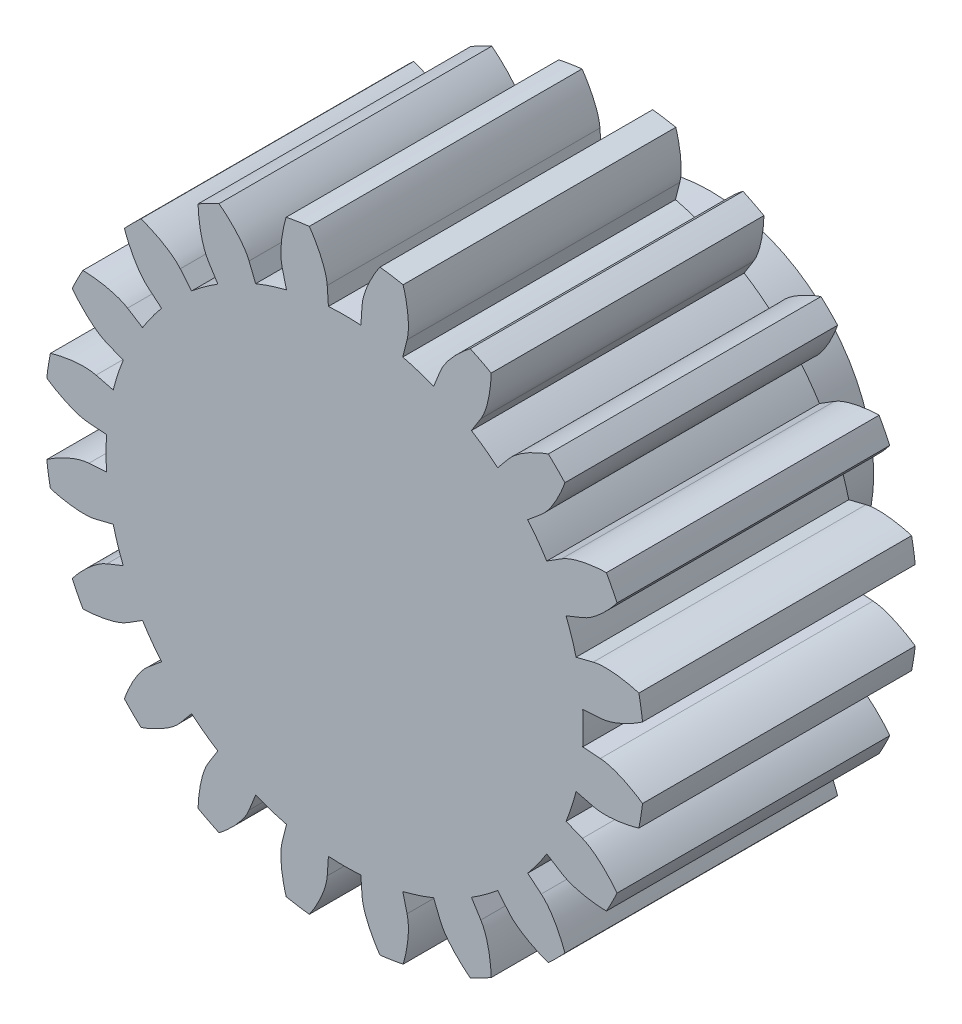
from build123d import *

# Parameters (mm, degrees)
SKETCH_1_R               = 5.5
SKETCH_1_R_2             = 1.475
EXTRUDE_1_DEPTH          = 5
CUT_EXTRUDE_1_DEPTH      = 10.246621004
PATTERN_CIRCULAR_1_DEPTH = 5
SKETCH_2_R               = 1.475
EXTRUDE_2_DEPTH          = 5
SKETCH_3_R               = 3
SKETCH_3_R_2             = 2
SKETCH_3_W               = 2
SKETCH_3_H               = 0.5
SKETCH_3_W_2             = 0.5
SKETCH_3_H_2             = 2
EXTRUDE_3_DEPTH          = 1.7
CUT_EXTRUDE_START        = -1
SKETCH_5_R               = 2
CUT_EXTRUDE_2_DEPTH      = 1


# Read off the part's stored shape, not the designer's step: 阵列(圆周)1
with BuildPart() as part:
    # 草图1 → 凸台-拉伸1 (new body)
    with BuildSketch(Plane.XY):
        Circle(SKETCH_1_R)
        Circle(SKETCH_1_R_2, mode=Mode.SUBTRACT)
    extrude(amount=EXTRUDE_1_DEPTH)

    # 草图1<3> → 切除-拉伸1 (cut, through all)
    with BuildSketch(Plane.XY):
        with BuildLine():
            Line((4.68759624, 0.319369739), (4.364881259, 0.297382905))
            ThreePointArc((4.364881259, 0.297382905), (4.372469583, 0.148777503), (4.375, 0))
            ThreePointArc((4.375, 0), (4.372469583, -0.148777503), (4.364881259, -0.297382905))
            Line((4.364881259, -0.297382905), (4.68759624, -0.319369739))
            add(Edge.make_bspline(
                [(4.68759624, -0.319369739), (4.723328518, -0.321804208), (4.822539562, -0.336024472), (5.006239619, -0.392562489), (5.199142564, -0.482491423), (5.35109765, -0.572850293), (5.444197274, -0.635344688), (5.461765036, -0.647396861)],
                knots=[0, 0, 0, 0, 0, 0.005604068, 0.015718248, 0.029959916, 0.033300536, 0.033300536, 0.033300536, 0.033300536, 0.033300536], degree=4))
            ThreePointArc((5.461765036, -0.647396861), (5.490432938, -0.324262474), (5.5, 0))
            ThreePointArc((5.5, 0), (5.490432938, 0.324262474), (5.461765036, 0.647396861))
            add(Edge.make_bspline(
                [(4.68759624, 0.319369739), (4.723328518, 0.321804208), (4.822539562, 0.336024472), (5.006239619, 0.392562489), (5.199142564, 0.482491423), (5.35109765, 0.572850293), (5.444197274, 0.635344688), (5.461765036, 0.647396861)],
                knots=[0, 0, 0, 0, 0, 0.005604068, 0.015718248, 0.029959916, 0.033300536, 0.033300536, 0.033300536, 0.033300536, 0.033300536], degree=4))
        make_face()
    extrude(amount=CUT_EXTRUDE_1_DEPTH, mode=Mode.SUBTRACT)

    # 阵列(圆周)1 outline → 阵列(圆周)1 (cut)
    with BuildSketch(Plane.XY):
        with BuildLine():
            Line((4.243145136, 1.065994538), (4.556859627, 1.14480823))
            add(Edge.make_bspline(
                [(4.556859627, 1.14480823), (4.591595335, 1.153534793), (4.690344948, 1.170668417), (4.882525293, 1.173664007), (5.093776464, 1.147746796), (5.266216765, 1.108767108), (5.374071599, 1.078100773), (5.39450386, 1.072067212)],
                knots=[0, 0, 0, 0, 0, 0.005604068, 0.015718248, 0.029959916, 0.033300536, 0.033300536, 0.033300536, 0.033300536, 0.033300536], degree=4))
            ThreePointArc((5.39450386, 1.072067212), (5.23081084, 1.699593469), (4.994390596, 2.303489219))
            add(Edge.make_bspline(
                [(4.359478273, 1.752285572), (4.392709397, 1.765642771), (4.482670403, 1.809824945), (4.639908332, 1.920362233), (4.795580365, 2.065500021), (4.912175813, 2.198393117), (4.981406987, 2.286598184), (4.994390596, 2.303489219)],
                knots=[0, 0, 0, 0, 0, 0.005604068, 0.015718248, 0.029959916, 0.033300536, 0.033300536, 0.033300536, 0.033300536, 0.033300536], degree=4))
            Line((4.359478273, 1.752285572), (4.059352393, 1.631650437))
            ThreePointArc((4.059352393, 1.631650437), (4.160872259, 1.35194935), (4.243145136, 1.065994538))
        make_face()
        with BuildLine():
            add(Edge.make_bspline(
                [(4.359478273, -1.752285572), (4.392709397, -1.765642771), (4.482670403, -1.809824945), (4.639908332, -1.920362233), (4.795580365, -2.065500021), (4.912175813, -2.198393117), (4.981406987, -2.286598184), (4.994390595, -2.303489218)],
                knots=[0, 0, 0, 0, 0, 0.005604068, 0.015718248, 0.029959916, 0.033300536, 0.033300536, 0.033300536, 0.033300536, 0.033300536], degree=4))
            ThreePointArc((4.994390595, -2.303489218), (5.23081084, -1.699593469), (5.39450386, -1.072067212))
            add(Edge.make_bspline(
                [(4.556859627, -1.14480823), (4.591595335, -1.153534793), (4.690344948, -1.170668417), (4.882525293, -1.173664007), (5.093776464, -1.147746796), (5.266216765, -1.108767108), (5.374071599, -1.078100773), (5.39450386, -1.072067212)],
                knots=[0, 0, 0, 0, 0, 0.005604068, 0.015718248, 0.029959916, 0.033300536, 0.033300536, 0.033300536, 0.033300536, 0.033300536], degree=4))
            Line((4.556859627, -1.14480823), (4.243145136, -1.065994538))
            ThreePointArc((4.243145136, -1.065994538), (4.160872259, -1.35194935), (4.059352393, -1.631650437))
            Line((4.059352393, -1.631650437), (4.359478273, -1.752285572))
        make_face()
        with BuildLine():
            add(Edge.make_bspline(
                [(3.604624198, -3.013675485), (3.632101274, -3.036647918), (3.704006232, -3.106467142), (3.819390489, -3.260183543), (3.922593347, -3.446323085), (3.992415983, -3.608741904), (4.031001877, -3.714023518), (4.038130406, -3.734100002)],
                knots=[0, 0, 0, 0, 0, 0.005604068, 0.015718248, 0.029959916, 0.033300536, 0.033300536, 0.033300536, 0.033300536, 0.033300536], degree=4))
            ThreePointArc((4.038130406, -3.734100002), (4.449593469, -3.232818888), (4.799191061, -2.686589877))
            add(Edge.make_bspline(
                [(3.980065843, -2.496924392), (4.010404809, -2.515957772), (4.099026691, -2.562768124), (4.280875372, -2.625004093), (4.489796033, -2.665635562), (4.665841891, -2.681850659), (4.777894353, -2.686014218), (4.799191061, -2.686589877)],
                knots=[0, 0, 0, 0, 0, 0.005604068, 0.015718248, 0.029959916, 0.033300536, 0.033300536, 0.033300536, 0.033300536, 0.033300536], degree=4))
            Line((3.980065843, -2.496924392), (3.706060403, -2.325025008))
            ThreePointArc((3.706060403, -2.325025008), (3.53944935, -2.571560479), (3.356465831, -2.806200656))
            Line((3.356465831, -2.806200656), (3.604624198, -3.013675485))
        make_face()
        with BuildLine():
            add(Edge.make_bspline(
                [(2.496924392, -3.980065843), (2.515957772, -4.010404809), (2.562768124, -4.099026691), (2.625004093, -4.280875372), (2.665635562, -4.489796033), (2.681850659, -4.665841891), (2.686014218, -4.777894353), (2.686589877, -4.79919106)],
                knots=[0, 0, 0, 0, 0, 0.005604068, 0.015718248, 0.029959916, 0.033300536, 0.033300536, 0.033300536, 0.033300536, 0.033300536], degree=4))
            ThreePointArc((2.686589877, -4.79919106), (3.232818888, -4.449593469), (3.734100002, -4.038130406))
            add(Edge.make_bspline(
                [(3.013675485, -3.604624198), (3.036647918, -3.632101274), (3.106467142, -3.704006232), (3.260183543, -3.819390489), (3.446323085, -3.922593347), (3.608741904, -3.992415983), (3.714023518, -4.031001877), (3.734100002, -4.038130406)],
                knots=[0, 0, 0, 0, 0, 0.005604068, 0.015718248, 0.029959916, 0.033300536, 0.033300536, 0.033300536, 0.033300536, 0.033300536], degree=4))
            Line((3.013675485, -3.604624198), (2.806200656, -3.356465831))
            ThreePointArc((2.806200656, -3.356465831), (2.571560479, -3.53944935), (2.325025008, -3.706060403))
            Line((2.325025008, -3.706060403), (2.496924392, -3.980065843))
        make_face()
        with BuildLine():
            add(Edge.make_bspline(
                [(1.14480823, -4.556859627), (1.153534793, -4.591595335), (1.170668417, -4.690344948), (1.173664007, -4.882525293), (1.147746796, -5.093776464), (1.108767108, -5.266216765), (1.078100773, -5.374071599), (1.072067212, -5.39450386)],
                knots=[0, 0, 0, 0, 0, 0.005604068, 0.015718248, 0.029959916, 0.033300536, 0.033300536, 0.033300536, 0.033300536, 0.033300536], degree=4))
            ThreePointArc((1.072067212, -5.39450386), (1.699593469, -5.23081084), (2.303489219, -4.994390596))
            add(Edge.make_bspline(
                [(1.752285572, -4.359478273), (1.765642771, -4.392709397), (1.809824945, -4.482670403), (1.920362233, -4.639908332), (2.065500021, -4.795580365), (2.198393117, -4.912175813), (2.286598184, -4.981406987), (2.303489219, -4.994390596)],
                knots=[0, 0, 0, 0, 0, 0.005604068, 0.015718248, 0.029959916, 0.033300536, 0.033300536, 0.033300536, 0.033300536, 0.033300536], degree=4))
            Line((1.752285572, -4.359478273), (1.631650437, -4.059352393))
            ThreePointArc((1.631650437, -4.059352393), (1.35194935, -4.160872259), (1.065994538, -4.243145136))
            Line((1.065994538, -4.243145136), (1.14480823, -4.556859627))
        make_face()
        with BuildLine():
            add(Edge.make_bspline(
                [(-0.319369739, -4.68759624), (-0.321804208, -4.723328518), (-0.336024472, -4.822539562), (-0.392562489, -5.006239619), (-0.482491423, -5.199142564), (-0.572850293, -5.35109765), (-0.635344688, -5.444197274), (-0.647396861, -5.461765036)],
                knots=[0, 0, 0, 0, 0, 0.005604068, 0.015718248, 0.029959916, 0.033300536, 0.033300536, 0.033300536, 0.033300536, 0.033300536], degree=4))
            ThreePointArc((-0.647396861, -5.461765036), (0, -5.5), (0.647396861, -5.461765036))
            add(Edge.make_bspline(
                [(0.319369739, -4.68759624), (0.321804208, -4.723328518), (0.336024472, -4.822539562), (0.392562489, -5.006239619), (0.482491423, -5.199142564), (0.572850293, -5.35109765), (0.635344688, -5.444197274), (0.647396861, -5.461765036)],
                knots=[0, 0, 0, 0, 0, 0.005604068, 0.015718248, 0.029959916, 0.033300536, 0.033300536, 0.033300536, 0.033300536, 0.033300536], degree=4))
            Line((0.319369739, -4.68759624), (0.297382905, -4.364881259))
            ThreePointArc((0.297382905, -4.364881259), (0, -4.375), (-0.297382905, -4.364881259))
            Line((-0.297382905, -4.364881259), (-0.319369739, -4.68759624))
        make_face()
        with BuildLine():
            add(Edge.make_bspline(
                [(-1.752285572, -4.359478273), (-1.765642771, -4.392709397), (-1.809824945, -4.482670403), (-1.920362233, -4.639908332), (-2.065500021, -4.795580365), (-2.198393117, -4.912175813), (-2.286598184, -4.981406987), (-2.303489218, -4.994390595)],
                knots=[0, 0, 0, 0, 0, 0.005604068, 0.015718248, 0.029959916, 0.033300536, 0.033300536, 0.033300536, 0.033300536, 0.033300536], degree=4))
            ThreePointArc((-2.303489218, -4.994390595), (-1.699593469, -5.23081084), (-1.072067212, -5.39450386))
            add(Edge.make_bspline(
                [(-1.14480823, -4.556859627), (-1.153534793, -4.591595335), (-1.170668417, -4.690344948), (-1.173664007, -4.882525293), (-1.147746796, -5.093776464), (-1.108767108, -5.266216765), (-1.078100773, -5.374071599), (-1.072067212, -5.39450386)],
                knots=[0, 0, 0, 0, 0, 0.005604068, 0.015718248, 0.029959916, 0.033300536, 0.033300536, 0.033300536, 0.033300536, 0.033300536], degree=4))
            Line((-1.14480823, -4.556859627), (-1.065994538, -4.243145136))
            ThreePointArc((-1.065994538, -4.243145136), (-1.35194935, -4.160872259), (-1.631650437, -4.059352393))
            Line((-1.631650437, -4.059352393), (-1.752285572, -4.359478273))
        make_face()
        with BuildLine():
            add(Edge.make_bspline(
                [(-3.013675485, -3.604624198), (-3.036647918, -3.632101274), (-3.106467142, -3.704006232), (-3.260183543, -3.819390489), (-3.446323085, -3.922593347), (-3.608741904, -3.992415983), (-3.714023518, -4.031001877), (-3.734100002, -4.038130406)],
                knots=[0, 0, 0, 0, 0, 0.005604068, 0.015718248, 0.029959916, 0.033300536, 0.033300536, 0.033300536, 0.033300536, 0.033300536], degree=4))
            ThreePointArc((-3.734100002, -4.038130406), (-3.232818888, -4.449593469), (-2.686589877, -4.79919106))
            add(Edge.make_bspline(
                [(-2.496924392, -3.980065843), (-2.515957772, -4.010404809), (-2.562768124, -4.099026691), (-2.625004093, -4.280875372), (-2.665635562, -4.489796033), (-2.681850659, -4.665841891), (-2.686014218, -4.777894353), (-2.686589877, -4.79919106)],
                knots=[0, 0, 0, 0, 0, 0.005604068, 0.015718248, 0.029959916, 0.033300536, 0.033300536, 0.033300536, 0.033300536, 0.033300536], degree=4))
            Line((-2.496924392, -3.980065843), (-2.325025008, -3.706060403))
            ThreePointArc((-2.325025008, -3.706060403), (-2.571560479, -3.53944935), (-2.806200656, -3.356465831))
            Line((-2.806200656, -3.356465831), (-3.013675485, -3.604624198))
        make_face()
        with BuildLine():
            add(Edge.make_bspline(
                [(-3.980065843, -2.496924392), (-4.010404809, -2.515957772), (-4.099026691, -2.562768124), (-4.280875372, -2.625004093), (-4.489796033, -2.665635562), (-4.665841891, -2.681850659), (-4.777894353, -2.686014218), (-4.79919106, -2.686589877)],
                knots=[0, 0, 0, 0, 0, 0.005604068, 0.015718248, 0.029959916, 0.033300536, 0.033300536, 0.033300536, 0.033300536, 0.033300536], degree=4))
            ThreePointArc((-4.79919106, -2.686589877), (-4.449593469, -3.232818888), (-4.038130406, -3.734100002))
            add(Edge.make_bspline(
                [(-3.604624198, -3.013675485), (-3.632101274, -3.036647918), (-3.704006232, -3.106467142), (-3.819390489, -3.260183543), (-3.922593347, -3.446323085), (-3.992415983, -3.608741904), (-4.031001877, -3.714023518), (-4.038130406, -3.734100002)],
                knots=[0, 0, 0, 0, 0, 0.005604068, 0.015718248, 0.029959916, 0.033300536, 0.033300536, 0.033300536, 0.033300536, 0.033300536], degree=4))
            Line((-3.604624198, -3.013675485), (-3.356465831, -2.806200656))
            ThreePointArc((-3.356465831, -2.806200656), (-3.53944935, -2.571560479), (-3.706060403, -2.325025008))
            Line((-3.706060403, -2.325025008), (-3.980065843, -2.496924392))
        make_face()
        with BuildLine():
            add(Edge.make_bspline(
                [(-4.556859627, -1.14480823), (-4.591595335, -1.153534793), (-4.690344948, -1.170668417), (-4.882525293, -1.173664007), (-5.093776464, -1.147746796), (-5.266216765, -1.108767108), (-5.374071599, -1.078100773), (-5.39450386, -1.072067212)],
                knots=[0, 0, 0, 0, 0, 0.005604068, 0.015718248, 0.029959916, 0.033300536, 0.033300536, 0.033300536, 0.033300536, 0.033300536], degree=4))
            ThreePointArc((-5.39450386, -1.072067212), (-5.23081084, -1.699593469), (-4.994390596, -2.303489218))
            add(Edge.make_bspline(
                [(-4.359478273, -1.752285572), (-4.392709397, -1.765642771), (-4.482670403, -1.809824945), (-4.639908332, -1.920362233), (-4.795580365, -2.065500021), (-4.912175813, -2.198393117), (-4.981406987, -2.286598184), (-4.994390596, -2.303489218)],
                knots=[0, 0, 0, 0, 0, 0.005604068, 0.015718248, 0.029959916, 0.033300536, 0.033300536, 0.033300536, 0.033300536, 0.033300536], degree=4))
            Line((-4.359478273, -1.752285572), (-4.059352393, -1.631650437))
            ThreePointArc((-4.059352393, -1.631650437), (-4.160872259, -1.35194935), (-4.243145136, -1.065994538))
            Line((-4.243145136, -1.065994538), (-4.556859627, -1.14480823))
        make_face()
        with BuildLine():
            add(Edge.make_bspline(
                [(-4.68759624, 0.319369739), (-4.723328518, 0.321804208), (-4.822539562, 0.336024472), (-5.006239619, 0.392562489), (-5.199142564, 0.482491423), (-5.35109765, 0.572850293), (-5.444197274, 0.635344688), (-5.461765036, 0.647396861)],
                knots=[0, 0, 0, 0, 0, 0.005604068, 0.015718248, 0.029959916, 0.033300536, 0.033300536, 0.033300536, 0.033300536, 0.033300536], degree=4))
            ThreePointArc((-5.461765036, 0.647396861), (-5.5, 0), (-5.461765036, -0.647396861))
            add(Edge.make_bspline(
                [(-4.68759624, -0.319369739), (-4.723328518, -0.321804208), (-4.822539562, -0.336024472), (-5.006239619, -0.392562489), (-5.199142564, -0.482491423), (-5.35109765, -0.572850293), (-5.444197274, -0.635344688), (-5.461765036, -0.647396861)],
                knots=[0, 0, 0, 0, 0, 0.005604068, 0.015718248, 0.029959916, 0.033300536, 0.033300536, 0.033300536, 0.033300536, 0.033300536], degree=4))
            Line((-4.68759624, -0.319369739), (-4.364881259, -0.297382905))
            ThreePointArc((-4.364881259, -0.297382905), (-4.375, 0), (-4.364881259, 0.297382905))
            Line((-4.364881259, 0.297382905), (-4.68759624, 0.319369739))
        make_face()
        with BuildLine():
            add(Edge.make_bspline(
                [(-4.359478273, 1.752285572), (-4.392709397, 1.765642771), (-4.482670403, 1.809824945), (-4.639908332, 1.920362233), (-4.795580365, 2.065500021), (-4.912175813, 2.198393117), (-4.981406987, 2.286598184), (-4.994390595, 2.303489218)],
                knots=[0, 0, 0, 0, 0, 0.005604068, 0.015718248, 0.029959916, 0.033300536, 0.033300536, 0.033300536, 0.033300536, 0.033300536], degree=4))
            ThreePointArc((-4.994390595, 2.303489218), (-5.23081084, 1.699593469), (-5.39450386, 1.072067212))
            add(Edge.make_bspline(
                [(-4.556859627, 1.14480823), (-4.591595335, 1.153534793), (-4.690344948, 1.170668417), (-4.882525293, 1.173664007), (-5.093776464, 1.147746796), (-5.266216765, 1.108767108), (-5.374071599, 1.078100773), (-5.39450386, 1.072067212)],
                knots=[0, 0, 0, 0, 0, 0.005604068, 0.015718248, 0.029959916, 0.033300536, 0.033300536, 0.033300536, 0.033300536, 0.033300536], degree=4))
            Line((-4.556859627, 1.14480823), (-4.243145136, 1.065994538))
            ThreePointArc((-4.243145136, 1.065994538), (-4.160872259, 1.35194935), (-4.059352393, 1.631650437))
            Line((-4.059352393, 1.631650437), (-4.359478273, 1.752285572))
        make_face()
        with BuildLine():
            add(Edge.make_bspline(
                [(-3.604624198, 3.013675485), (-3.632101274, 3.036647918), (-3.704006232, 3.106467142), (-3.819390489, 3.260183543), (-3.922593347, 3.446323085), (-3.992415983, 3.608741904), (-4.031001877, 3.714023518), (-4.038130406, 3.734100002)],
                knots=[0, 0, 0, 0, 0, 0.005604068, 0.015718248, 0.029959916, 0.033300536, 0.033300536, 0.033300536, 0.033300536, 0.033300536], degree=4))
            ThreePointArc((-4.038130406, 3.734100002), (-4.449593469, 3.232818888), (-4.79919106, 2.686589877))
            add(Edge.make_bspline(
                [(-3.980065843, 2.496924392), (-4.010404809, 2.515957772), (-4.099026691, 2.562768124), (-4.280875372, 2.625004093), (-4.489796033, 2.665635562), (-4.665841891, 2.681850659), (-4.777894353, 2.686014218), (-4.79919106, 2.686589877)],
                knots=[0, 0, 0, 0, 0, 0.005604068, 0.015718248, 0.029959916, 0.033300536, 0.033300536, 0.033300536, 0.033300536, 0.033300536], degree=4))
            Line((-3.980065843, 2.496924392), (-3.706060403, 2.325025008))
            ThreePointArc((-3.706060403, 2.325025008), (-3.53944935, 2.571560479), (-3.356465831, 2.806200656))
            Line((-3.356465831, 2.806200656), (-3.604624198, 3.013675485))
        make_face()
        with BuildLine():
            add(Edge.make_bspline(
                [(-2.496924392, 3.980065843), (-2.515957772, 4.010404809), (-2.562768124, 4.099026691), (-2.625004093, 4.280875372), (-2.665635562, 4.489796033), (-2.681850659, 4.665841891), (-2.686014218, 4.777894353), (-2.686589877, 4.79919106)],
                knots=[0, 0, 0, 0, 0, 0.005604068, 0.015718248, 0.029959916, 0.033300536, 0.033300536, 0.033300536, 0.033300536, 0.033300536], degree=4))
            ThreePointArc((-2.686589877, 4.79919106), (-3.232818888, 4.449593469), (-3.734100002, 4.038130406))
            add(Edge.make_bspline(
                [(-3.013675485, 3.604624198), (-3.036647918, 3.632101274), (-3.106467142, 3.704006232), (-3.260183543, 3.819390489), (-3.446323085, 3.922593347), (-3.608741904, 3.992415983), (-3.714023518, 4.031001877), (-3.734100002, 4.038130406)],
                knots=[0, 0, 0, 0, 0, 0.005604068, 0.015718248, 0.029959916, 0.033300536, 0.033300536, 0.033300536, 0.033300536, 0.033300536], degree=4))
            Line((-3.013675485, 3.604624198), (-2.806200656, 3.356465831))
            ThreePointArc((-2.806200656, 3.356465831), (-2.571560479, 3.53944935), (-2.325025008, 3.706060403))
            Line((-2.325025008, 3.706060403), (-2.496924392, 3.980065843))
        make_face()
        with BuildLine():
            add(Edge.make_bspline(
                [(-1.14480823, 4.556859627), (-1.153534793, 4.591595335), (-1.170668417, 4.690344948), (-1.173664007, 4.882525293), (-1.147746796, 5.093776464), (-1.108767108, 5.266216765), (-1.078100773, 5.374071599), (-1.072067212, 5.39450386)],
                knots=[0, 0, 0, 0, 0, 0.005604068, 0.015718248, 0.029959916, 0.033300536, 0.033300536, 0.033300536, 0.033300536, 0.033300536], degree=4))
            ThreePointArc((-1.072067212, 5.39450386), (-1.699593469, 5.23081084), (-2.303489219, 4.994390596))
            add(Edge.make_bspline(
                [(-1.752285572, 4.359478273), (-1.765642771, 4.392709397), (-1.809824945, 4.482670403), (-1.920362233, 4.639908332), (-2.065500021, 4.795580365), (-2.198393117, 4.912175813), (-2.286598184, 4.981406987), (-2.303489219, 4.994390596)],
                knots=[0, 0, 0, 0, 0, 0.005604068, 0.015718248, 0.029959916, 0.033300536, 0.033300536, 0.033300536, 0.033300536, 0.033300536], degree=4))
            Line((-1.752285572, 4.359478273), (-1.631650437, 4.059352393))
            ThreePointArc((-1.631650437, 4.059352393), (-1.35194935, 4.160872259), (-1.065994538, 4.243145136))
            Line((-1.065994538, 4.243145136), (-1.14480823, 4.556859627))
        make_face()
        with BuildLine():
            add(Edge.make_bspline(
                [(0.319369739, 4.68759624), (0.321804208, 4.723328518), (0.336024472, 4.822539562), (0.392562489, 5.006239619), (0.482491423, 5.199142564), (0.572850293, 5.35109765), (0.635344688, 5.444197274), (0.647396861, 5.461765036)],
                knots=[0, 0, 0, 0, 0, 0.005604068, 0.015718248, 0.029959916, 0.033300536, 0.033300536, 0.033300536, 0.033300536, 0.033300536], degree=4))
            ThreePointArc((0.647396861, 5.461765036), (0, 5.5), (-0.647396861, 5.461765036))
            add(Edge.make_bspline(
                [(-0.319369739, 4.68759624), (-0.321804208, 4.723328518), (-0.336024472, 4.822539562), (-0.392562489, 5.006239619), (-0.482491423, 5.199142564), (-0.572850293, 5.35109765), (-0.635344688, 5.444197274), (-0.647396861, 5.461765036)],
                knots=[0, 0, 0, 0, 0, 0.005604068, 0.015718248, 0.029959916, 0.033300536, 0.033300536, 0.033300536, 0.033300536, 0.033300536], degree=4))
            Line((-0.319369739, 4.68759624), (-0.297382905, 4.364881259))
            ThreePointArc((-0.297382905, 4.364881259), (0, 4.375), (0.297382905, 4.364881259))
            Line((0.297382905, 4.364881259), (0.319369739, 4.68759624))
        make_face()
        with BuildLine():
            add(Edge.make_bspline(
                [(1.752285572, 4.359478273), (1.765642771, 4.392709397), (1.809824945, 4.482670403), (1.920362233, 4.639908332), (2.065500021, 4.795580365), (2.198393117, 4.912175813), (2.286598184, 4.981406987), (2.303489218, 4.994390595)],
                knots=[0, 0, 0, 0, 0, 0.005604068, 0.015718248, 0.029959916, 0.033300536, 0.033300536, 0.033300536, 0.033300536, 0.033300536], degree=4))
            ThreePointArc((2.303489218, 4.994390595), (1.699593469, 5.23081084), (1.072067212, 5.39450386))
            add(Edge.make_bspline(
                [(1.14480823, 4.556859627), (1.153534793, 4.591595335), (1.170668417, 4.690344948), (1.173664007, 4.882525293), (1.147746796, 5.093776464), (1.108767108, 5.266216765), (1.078100773, 5.374071599), (1.072067212, 5.39450386)],
                knots=[0, 0, 0, 0, 0, 0.005604068, 0.015718248, 0.029959916, 0.033300536, 0.033300536, 0.033300536, 0.033300536, 0.033300536], degree=4))
            Line((1.14480823, 4.556859627), (1.065994538, 4.243145136))
            ThreePointArc((1.065994538, 4.243145136), (1.35194935, 4.160872259), (1.631650437, 4.059352393))
            Line((1.631650437, 4.059352393), (1.752285572, 4.359478273))
        make_face()
        with BuildLine():
            add(Edge.make_bspline(
                [(3.013675485, 3.604624198), (3.036647918, 3.632101274), (3.106467142, 3.704006232), (3.260183543, 3.819390489), (3.446323085, 3.922593347), (3.608741904, 3.992415983), (3.714023518, 4.031001877), (3.734100002, 4.038130406)],
                knots=[0, 0, 0, 0, 0, 0.005604068, 0.015718248, 0.029959916, 0.033300536, 0.033300536, 0.033300536, 0.033300536, 0.033300536], degree=4))
            ThreePointArc((3.734100002, 4.038130406), (3.232818888, 4.449593469), (2.686589877, 4.799191061))
            add(Edge.make_bspline(
                [(2.496924392, 3.980065843), (2.515957772, 4.010404809), (2.562768124, 4.099026691), (2.625004093, 4.280875372), (2.665635562, 4.489796033), (2.681850659, 4.665841891), (2.686014218, 4.777894353), (2.686589877, 4.799191061)],
                knots=[0, 0, 0, 0, 0, 0.005604068, 0.015718248, 0.029959916, 0.033300536, 0.033300536, 0.033300536, 0.033300536, 0.033300536], degree=4))
            Line((2.496924392, 3.980065843), (2.325025008, 3.706060403))
            ThreePointArc((2.325025008, 3.706060403), (2.571560479, 3.53944935), (2.806200656, 3.356465831))
            Line((2.806200656, 3.356465831), (3.013675485, 3.604624198))
        make_face()
        with BuildLine():
            add(Edge.make_bspline(
                [(3.980065843, 2.496924392), (4.010404809, 2.515957772), (4.099026691, 2.562768124), (4.280875372, 2.625004093), (4.489796033, 2.665635562), (4.665841891, 2.681850659), (4.777894353, 2.686014218), (4.79919106, 2.686589877)],
                knots=[0, 0, 0, 0, 0, 0.005604068, 0.015718248, 0.029959916, 0.033300536, 0.033300536, 0.033300536, 0.033300536, 0.033300536], degree=4))
            ThreePointArc((4.79919106, 2.686589877), (4.449593469, 3.232818888), (4.038130406, 3.734100002))
            add(Edge.make_bspline(
                [(3.604624198, 3.013675485), (3.632101274, 3.036647918), (3.704006232, 3.106467142), (3.819390489, 3.260183543), (3.922593347, 3.446323085), (3.992415983, 3.608741904), (4.031001877, 3.714023518), (4.038130406, 3.734100002)],
                knots=[0, 0, 0, 0, 0, 0.005604068, 0.015718248, 0.029959916, 0.033300536, 0.033300536, 0.033300536, 0.033300536, 0.033300536], degree=4))
            Line((3.604624198, 3.013675485), (3.356465831, 2.806200656))
            ThreePointArc((3.356465831, 2.806200656), (3.53944935, 2.571560479), (3.706060403, 2.325025008))
            Line((3.706060403, 2.325025008), (3.980065843, 2.496924392))
        make_face()
    extrude(amount=PATTERN_CIRCULAR_1_DEPTH, mode=Mode.SUBTRACT)

    # 草图2 → 凸台-拉伸2 (add, through all)
    with BuildSketch(Plane.XY.offset(5)):
        Circle(SKETCH_2_R)
    extrude(amount=-EXTRUDE_2_DEPTH)

    # 草图3 → 凸台-拉伸3 (add)
    # profile 1 of 3: a face of its own
    with BuildSketch(Plane(origin=(0, 0, 0), x_dir=(-1, 0, 0), z_dir=(0, 0, -1))):
        with Locations(Location((0, 0, 0), (0, 0, 180))):
            Circle(SKETCH_3_R)
        Circle(SKETCH_3_R_2, mode=Mode.SUBTRACT)
    # profile 2 of 3: a face of its own
    with BuildSketch(Plane(origin=(0, 0, 0), x_dir=(-1, 0, 0), z_dir=(0, 0, -1))):
        Rectangle(SKETCH_3_W, SKETCH_3_H)
    # profile 3 of 3: a face of its own
    with BuildSketch(Plane(origin=(0, 0, 0), x_dir=(-1, 0, 0), z_dir=(0, 0, -1))):
        Rectangle(SKETCH_3_W_2, SKETCH_3_H_2)
    extrude(amount=EXTRUDE_3_DEPTH)

    # 草图5 → 切除-拉伸2 (cut)
    with BuildSketch(Plane(origin=(0, 0, -1.7), x_dir=(-1, 0, 0), z_dir=(0, 0, -1)).offset(CUT_EXTRUDE_START)):
        Circle(SKETCH_5_R)
    extrude(amount=CUT_EXTRUDE_2_DEPTH, mode=Mode.SUBTRACT)


solid = part.part
